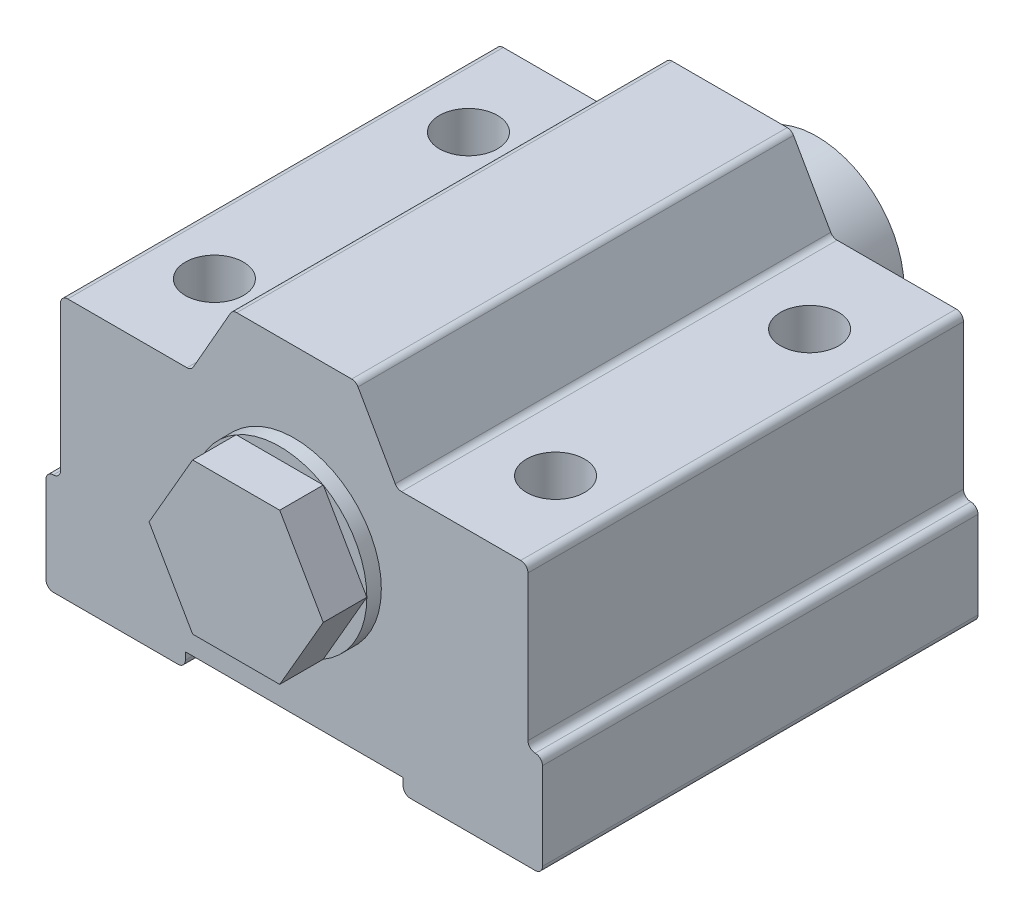
from build123d import *

# Parameters (mm, degrees)
SKETCH_2_R          = 6
EXTRUDE_1_DEPTH     = 30
SKETCH_2_3_R        = 6
EXTRUDE_2_DEPTH     = 6
EXTRUDE_START       = 31
SKETCH_2_4_R        = 6
EXTRUDE_3_DEPTH     = 1
CUT_EXTRUDE_1_REACH = 44.219
SKETCH_4_R          = 2
CUT_EXTRUDE_2_REACH = 48.015
SKETCH_5_W          = 1
SKETCH_5_H          = 11
SKETCH_5_W_2        = 15
SKETCH_5_H_2        = 1
FILLET_1_R          = 0.5
EXTRUDE_4_DEPTH     = 3


with BuildPart() as part:
    # 草图2 → 凸台-拉伸1 (new body)
    # profile 1 of 2: a face of its own
    with BuildSketch(Plane.XY):
        Polygon((17.1, 18), (17.1, 0), (-17.1, 0), (-17.1, 18), (-7.1, 18), (-4.25, 23), (4.25, 23), (7.1, 18), align=None)
        with Locations((0, 11.5)):
            Circle(SKETCH_2_R, mode=Mode.SUBTRACT)
    # profile 2 of 2: a face of its own
    with BuildSketch(Plane.XY):
        with Locations((0, 11.5)):
            Circle(SKETCH_2_R)
    extrude(amount=EXTRUDE_1_DEPTH)

    # 草图2<3> → 凸台-拉伸2 (add)
    with BuildSketch(Plane.XY):
        with Locations((0, 11.5)):
            Circle(SKETCH_2_3_R)
    extrude(amount=-EXTRUDE_2_DEPTH)

    # 草图2<4> → 凸台-拉伸3 (add)
    with BuildSketch(Plane.XY.offset(EXTRUDE_START)):
        with Locations((0, 11.5)):
            Circle(SKETCH_2_4_R)
    extrude(amount=-EXTRUDE_3_DEPTH)

    # 草图4 → 切除-拉伸1 (cut, up to next)
    with BuildSketch(Plane.XZ, mode=Mode.PRIVATE) as cut_extrude_1_sk1:
        with Locations((11.75, 23.75)):
            Circle(SKETCH_4_R)
    cut_extrude_1_tool1 = extrude(cut_extrude_1_sk1.sketch, amount=-CUT_EXTRUDE_1_REACH, mode=Mode.PRIVATE) & part.part
    # 草图4 → 切除-拉伸1 (cut, up to next)
    with BuildSketch(Plane.XZ, mode=Mode.PRIVATE) as cut_extrude_1_sk2:
        with Locations((11.75, 6.25)):
            Circle(SKETCH_4_R)
    cut_extrude_1_tool2 = extrude(cut_extrude_1_sk2.sketch, amount=-CUT_EXTRUDE_1_REACH, mode=Mode.PRIVATE) & part.part
    # 草图4 → 切除-拉伸1 (cut, up to next)
    with BuildSketch(Plane.XZ, mode=Mode.PRIVATE) as cut_extrude_1_sk3:
        with Locations((-11.75, 23.75)):
            Circle(SKETCH_4_R)
    cut_extrude_1_tool3 = extrude(cut_extrude_1_sk3.sketch, amount=-CUT_EXTRUDE_1_REACH, mode=Mode.PRIVATE) & part.part
    # 草图4 → 切除-拉伸1 (cut, up to next)
    with BuildSketch(Plane.XZ, mode=Mode.PRIVATE) as cut_extrude_1_sk4:
        with Locations((-11.75, 6.25)):
            Circle(SKETCH_4_R)
    cut_extrude_1_tool4 = extrude(cut_extrude_1_sk4.sketch, amount=-CUT_EXTRUDE_1_REACH, mode=Mode.PRIVATE) & part.part
    add(cut_extrude_1_tool1.solids().sort_by_distance((11.75, 0, 23.75))[0], mode=Mode.SUBTRACT)
    add(cut_extrude_1_tool2.solids().sort_by_distance((11.75, 0, 6.25))[0], mode=Mode.SUBTRACT)
    add(cut_extrude_1_tool3.solids().sort_by_distance((-11.75, 0, 23.75))[0], mode=Mode.SUBTRACT)
    add(cut_extrude_1_tool4.solids().sort_by_distance((-11.75, 0, 6.25))[0], mode=Mode.SUBTRACT)

    # 草图5 → 切除-拉伸2 (cut, up to next)
    with BuildSketch(Plane.XY.offset(30), mode=Mode.PRIVATE) as cut_extrude_2_sk1:
        with Locations((16.6, 12.5)):
            Rectangle(SKETCH_5_W, SKETCH_5_H)
    cut_extrude_2_tool1 = extrude(cut_extrude_2_sk1.sketch, amount=-CUT_EXTRUDE_2_REACH, mode=Mode.PRIVATE) & part.part
    # 草图5 → 切除-拉伸2 (cut, up to next)
    with BuildSketch(Plane.XY.offset(30), mode=Mode.PRIVATE) as cut_extrude_2_sk2:
        with Locations((-16.6, 12.5)):
            Rectangle(SKETCH_5_W, SKETCH_5_H)
    cut_extrude_2_tool2 = extrude(cut_extrude_2_sk2.sketch, amount=-CUT_EXTRUDE_2_REACH, mode=Mode.PRIVATE) & part.part
    # 草图5 → 切除-拉伸2 (cut, up to next)
    with BuildSketch(Plane.XY.offset(30), mode=Mode.PRIVATE) as cut_extrude_2_sk3:
        with Locations((0, 0.5)):
            Rectangle(SKETCH_5_W_2, SKETCH_5_H_2)
    cut_extrude_2_tool3 = extrude(cut_extrude_2_sk3.sketch, amount=-CUT_EXTRUDE_2_REACH, mode=Mode.PRIVATE) & part.part
    add(cut_extrude_2_tool1.solids().sort_by_distance((16.6, 12.5, 30))[0], mode=Mode.SUBTRACT)
    add(cut_extrude_2_tool2.solids().sort_by_distance((-16.6, 12.5, 30))[0], mode=Mode.SUBTRACT)
    add(cut_extrude_2_tool3.solids().sort_by_distance((0, 0.5, 30))[0], mode=Mode.SUBTRACT)

    # 圆角1
    fillet_1_edges = [part.edges().sort_by_distance(p)[0] for p in [
        (17.1, 0, 15),
        (7.5, 0, 15),
        (-7.5, 0, 15),
        (-17.1, 0, 15),
        (-17.1, 7, 15),
        (-16.1, 7, 15),
        (-16.1, 18, 15),
        (17.1, 7, 15),
        (16.1, 7, 15),
        (16.1, 18, 15),
        (-7.1, 18, 15),
        (7.1, 18, 15),
        (-4.25, 23, 15),
        (4.25, 23, 15),
    ]]
    fillet(fillet_1_edges, radius=FILLET_1_R - 0.0001)  # a hair under: the kernel refuses the full size

    # 草图6 → 凸台-拉伸4 (add)
    with BuildSketch(Plane.XY.offset(31)):
        Polygon((-3, 16.696152423), (3, 16.696152423), (6, 11.5), (3, 6.303847577), (-3, 6.303847577), (-6, 11.5), align=None)
    extrude(amount=EXTRUDE_4_DEPTH)


solid = part.part
